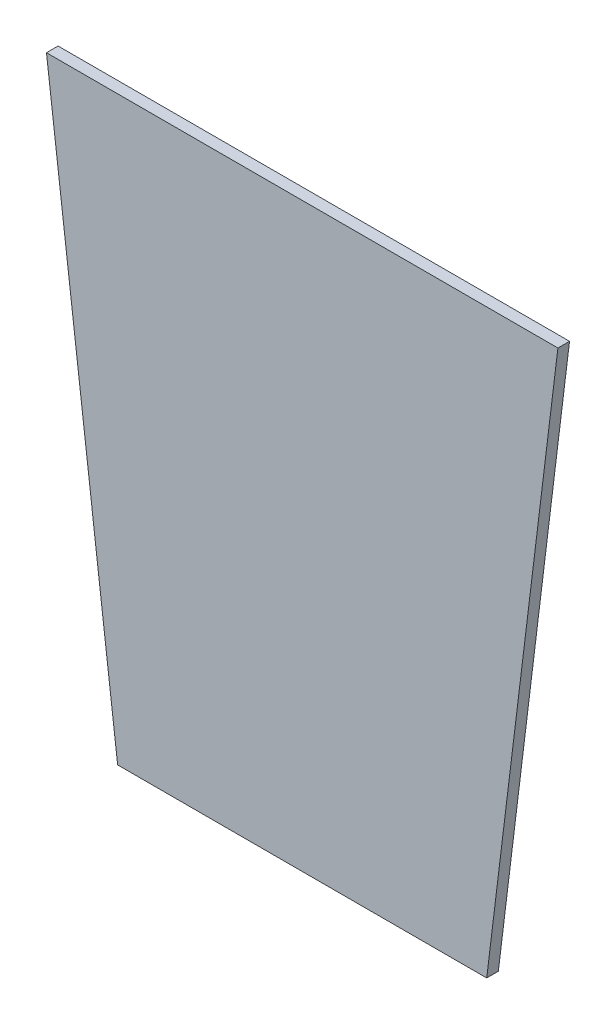
from build123d import *

# Parameters (mm, degrees)
BASE_FLANGE1_DEPTH = 4


# Sheet-metal steps are written as plain solids
with BuildPart() as part:
    # Sketch1 → Base-Flange1 (new body)
    with BuildSketch(Plane.XY):
        Polygon((-88, 200), (88, 200), (63.5, 0), (-63.5, 0), align=None)
    extrude(amount=-BASE_FLANGE1_DEPTH)


solid = part.part
